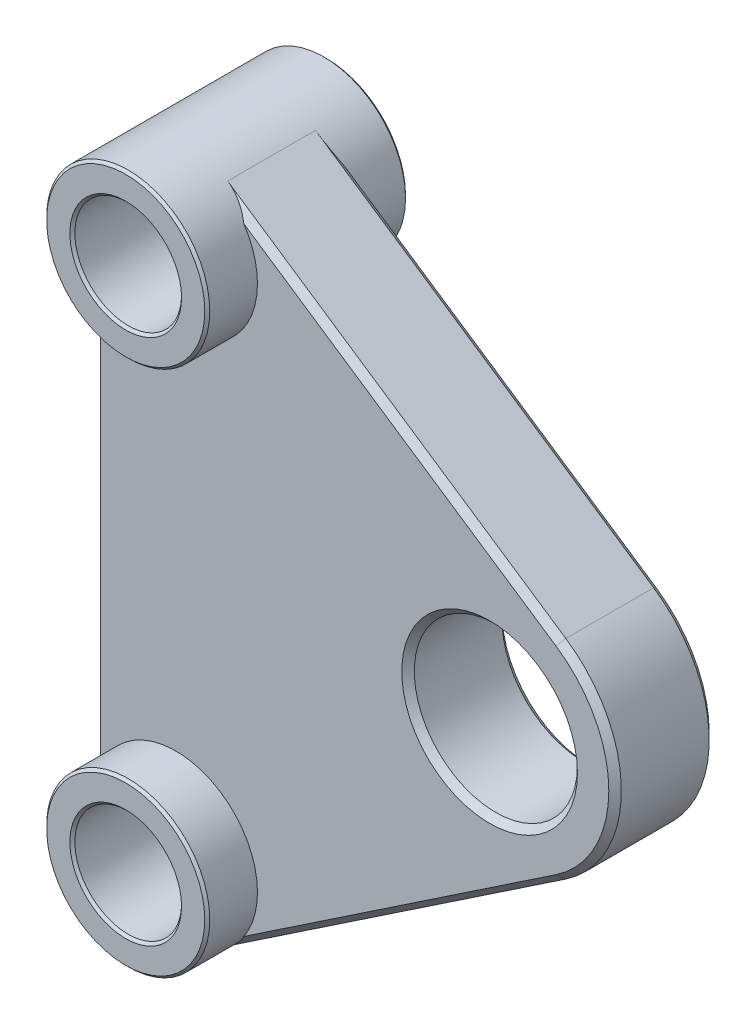
from build123d import *
from build123d.topology import SkipClean

# Parameters (mm, degrees)
SKETCH1_R           = 6.5
BOSS_EXTRUDE1_DEPTH = 4
SKETCH2_R           = 6.5
BOSS_EXTRUDE2_DEPTH = 8
SKETCH3_R           = 4.25
CUT_EXTRUDE4_DEPTH  = 48.299577165
CHAMFER2_SIZE       = 0.2
CHAMFER3_SIZE       = 0.5


with BuildPart() as part:
    # Sketch1 → Boss-Extrude1 (new, symmetric)
    with BuildSketch(Plane.XY):
        with BuildLine():
            Line((-6.5, -21), (-6.5, 21))
            ThreePointArc((-6.5, 21), (-3.057753594, 26.735864622), (3.62312091, 26.396572512))
            Line((3.62312091, 26.396572512), (30.574032169, 8.302419249))
            ThreePointArc((30.574032169, 8.302419249), (35, 0), (30.574032169, -8.302419249))
            Line((30.574032169, -8.302419249), (3.62312091, -26.396572512))
            ThreePointArc((3.62312091, -26.396572512), (-3.057753594, -26.735864622), (-6.5, -21))
        make_face()
        with Locations((25, 0)):
            Circle(SKETCH1_R, mode=Mode.SUBTRACT)
    extrude(amount=BOSS_EXTRUDE1_DEPTH, both=True)

    # Sketch2 → Boss-Extrude2 (add, symmetric)
    with SkipClean():  # the faces are left unmerged after this step: merging them gives an invalid solid
        with BuildSketch(Plane.XY):
            with Locations((0, 21)):
                Circle(SKETCH2_R)
            with Locations((0, -21)):
                Circle(SKETCH2_R)
        extrude(amount=BOSS_EXTRUDE2_DEPTH, both=True)
    add(part.part.scale(1), mode=Mode.REPLACE)  # the faces are merged on a copy

    # Sketch3 → Cut-Extrude4 (cut, through all)
    with BuildSketch(Plane.XY.offset(8)):
        with Locations((0, 21)):
            Circle(SKETCH3_R)
        with Locations((0, -21)):
            Circle(SKETCH3_R)
    extrude(amount=-CUT_EXTRUDE4_DEPTH, mode=Mode.SUBTRACT)

    # Chamfer2
    chamfer2_edges = [part.edges().sort_by_distance(p)[0] for p in [
        (-6.5, 21, -8),
        (-6.5, 21, 8),
        (-6.5, -21, -8),
        (-6.5, -21, 8),
        (-4.25, 21, -8),
        (-4.25, 21, 8),
        (-4.25, -21, -8),
        (-4.25, -21, 8),
    ]]
    chamfer(chamfer2_edges, length=CHAMFER2_SIZE)

    # Chamfer3
    # the kernel refuses this chamfer: 0.5 mm, written as the material it takes off along each edge
    with BuildSketch(Plane(origin=(25, 0, 4), x_dir=(0.557403216886901, 0.8302419248653579, 0), z_dir=(-0.8302419248653579, 0.557403216886901, 0))) as chamfer3_piece_1:
        Polygon((10, CHAMFER3_SIZE), (10 - CHAMFER3_SIZE, 0), (10, 0), align=None)
    revolve(axis=Axis((25, 0, 4), (0, 0, -1)), revolution_arc=112.247195119, mode=Mode.SUBTRACT)
    with BuildSketch(Plane(origin=(2.555561393, 27.113304697, 4), x_dir=(0.01532629007386634, 0.022828229523033896, -0.9996219169112968), z_dir=(0.8302419248653579, -0.5574032168869009, 0))) as chamfer3_piece_2_section:
        Polygon((CHAMFER3_SIZE * 0.999621916911, -CHAMFER3_SIZE * 0.0274958766106), (-CHAMFER3_SIZE * 0.0274958766106, -CHAMFER3_SIZE * 0.999621916911), (0, 0), align=None)
    chamfer3_piece_2 = extrude(amount=33.74735717, mode=Mode.PRIVATE)
    chamfer3_piece_2 = chamfer3_piece_2 - Plane(origin=(0, 21, 3.833161129), x_dir=(1, 0, 0), z_dir=(0, 0, 1)) * Cylinder(6.5, 70, mode=Mode.PRIVATE)
    add(chamfer3_piece_2, mode=Mode.SUBTRACT)
    with BuildSketch(Plane(origin=(25, 0, -4), x_dir=(1, 0, 0), z_dir=(0, -1, 0))) as chamfer3_piece_3:
        Polygon((6.5 + CHAMFER3_SIZE, 0), (6.5, CHAMFER3_SIZE), (6.5, 0), align=None)
    revolve(axis=Axis((25, 0, -4), (0, 0, 1)), mode=Mode.SUBTRACT)
    with BuildSketch(Plane(origin=(25, 0, 4), x_dir=(1, 0, 0), z_dir=(0, -1, 0))) as chamfer3_piece_4:
        Polygon((6.5, -CHAMFER3_SIZE), (6.5 + CHAMFER3_SIZE, 0), (6.5, 0), align=None)
    revolve(axis=Axis((25, 0, 4), (0, 0, 1)), mode=Mode.SUBTRACT)
    with BuildSketch(Plane(origin=(-6.5, -22.285841494, 4), x_dir=(-0.027495876610585623, 0, -0.9996219169112968), z_dir=(0, 1, 0))) as chamfer3_piece_5_section:
        Polygon((CHAMFER3_SIZE * 0.999621916911, -CHAMFER3_SIZE * 0.0274958766106), (-CHAMFER3_SIZE * 0.0274958766106, -CHAMFER3_SIZE * 0.999621916911), (0, 0), align=None)
    chamfer3_piece_5 = extrude(amount=44.571682988, mode=Mode.PRIVATE)
    chamfer3_piece_5 = chamfer3_piece_5 - Plane(origin=(0, -21, 3.832044631), x_dir=(1, 0, 0), z_dir=(0, 0, 1)) * Cylinder(6.5, 92, mode=Mode.PRIVATE)
    chamfer3_piece_5 = chamfer3_piece_5 - Plane(origin=(0, 21, 3.832044631), x_dir=(1, 0, 0), z_dir=(0, 0, 1)) * Cylinder(6.5, 92, mode=Mode.PRIVATE)
    add(chamfer3_piece_5, mode=Mode.SUBTRACT)
    with BuildSketch(Plane(origin=(-6.5, -22.285841494, -4), x_dir=(0.9996219169112968, 0, -0.027495876610585647), z_dir=(0, 1, 0))) as chamfer3_piece_6_section:
        Polygon((CHAMFER3_SIZE * 0.999621916911, -CHAMFER3_SIZE * 0.0274958766106), (-CHAMFER3_SIZE * 0.0274958766106, -CHAMFER3_SIZE * 0.999621916911), (0, 0), align=None)
    chamfer3_piece_6 = extrude(amount=44.571682988, mode=Mode.PRIVATE)
    chamfer3_piece_6 = chamfer3_piece_6 - Plane(origin=(0, -21, -3.832044585), x_dir=(1, 0, 0), z_dir=(0, 0, 1)) * Cylinder(6.5, 92, mode=Mode.PRIVATE)
    chamfer3_piece_6 = chamfer3_piece_6 - Plane(origin=(0, 21, -3.832044585), x_dir=(1, 0, 0), z_dir=(0, 0, 1)) * Cylinder(6.5, 92, mode=Mode.PRIVATE)
    add(chamfer3_piece_6, mode=Mode.SUBTRACT)
    with BuildSketch(Plane(origin=(2.555561393, 27.113304697, -4), x_dir=(-0.5571924721570072, -0.8299280244340339, -0.027495876610585664), z_dir=(0.8302419248653579, -0.5574032168869009, 0))) as chamfer3_piece_7_section:
        Polygon((CHAMFER3_SIZE * 0.999621916911, -CHAMFER3_SIZE * 0.0274958766106), (-CHAMFER3_SIZE * 0.0274958766106, -CHAMFER3_SIZE * 0.999621916911), (0, 0), align=None)
    chamfer3_piece_7 = extrude(amount=33.74735717, mode=Mode.PRIVATE)
    chamfer3_piece_7 = chamfer3_piece_7 - Plane(origin=(0, 21, -3.833161129), x_dir=(1, 0, 0), z_dir=(0, 0, 1)) * Cylinder(6.5, 70, mode=Mode.PRIVATE)
    add(chamfer3_piece_7, mode=Mode.SUBTRACT)
    with BuildSketch(Plane(origin=(25, 0, -4), x_dir=(0.557403216886901, 0.8302419248653579, 0), z_dir=(-0.8302419248653579, 0.557403216886901, 0))) as chamfer3_piece_8:
        Polygon((10 - CHAMFER3_SIZE, 0), (10, -CHAMFER3_SIZE), (10, 0), align=None)
    revolve(axis=Axis((25, 0, -4), (0, 0, -1)), revolution_arc=112.247195119, mode=Mode.SUBTRACT)
    with BuildSketch(Plane(origin=(30.574032169, -8.302419249, -4), x_dir=(-0.5571924721570071, 0.8299280244340339, -0.027495876610585612), z_dir=(-0.8302419248653579, -0.5574032168869009, 0))) as chamfer3_piece_9_section:
        Polygon((CHAMFER3_SIZE * 0.999621916911, -CHAMFER3_SIZE * 0.0274958766106), (-CHAMFER3_SIZE * 0.0274958766106, -CHAMFER3_SIZE * 0.999621916911), (0, 0), align=None)
    chamfer3_piece_9 = extrude(amount=33.74735717, mode=Mode.PRIVATE)
    chamfer3_piece_9 = chamfer3_piece_9 - Plane(origin=(0, -21, -3.833161128), x_dir=(1, 0, 0), z_dir=(0, 0, 1)) * Cylinder(6.5, 70, mode=Mode.PRIVATE)
    add(chamfer3_piece_9, mode=Mode.SUBTRACT)
    with BuildSketch(Plane(origin=(30.574032169, -8.302419249, 4), x_dir=(0.015326290073865267, -0.022828229523032303, -0.9996219169112968), z_dir=(-0.8302419248653579, -0.5574032168869009, 0))) as chamfer3_piece_10_section:
        Polygon((CHAMFER3_SIZE * 0.999621916911, -CHAMFER3_SIZE * 0.0274958766106), (-CHAMFER3_SIZE * 0.0274958766106, -CHAMFER3_SIZE * 0.999621916911), (0, 0), align=None)
    chamfer3_piece_10 = extrude(amount=33.74735717, mode=Mode.PRIVATE)
    chamfer3_piece_10 = chamfer3_piece_10 - Plane(origin=(0, -21, 3.833161129), x_dir=(1, 0, 0), z_dir=(0, 0, 1)) * Cylinder(6.5, 70, mode=Mode.PRIVATE)
    add(chamfer3_piece_10, mode=Mode.SUBTRACT)


solid = part.part
